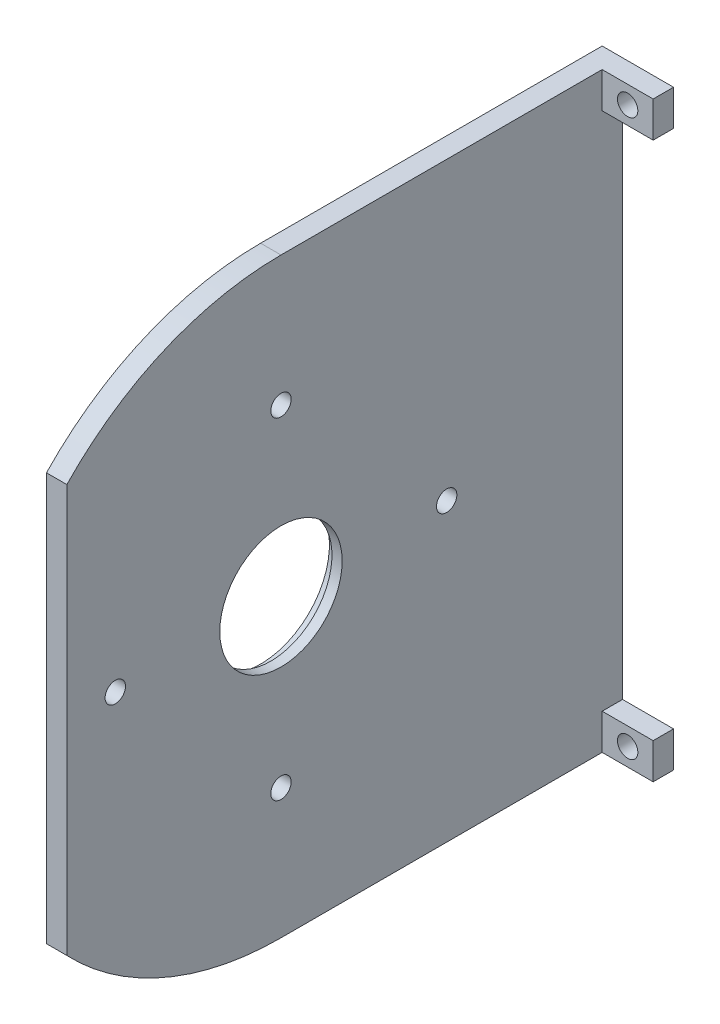
from build123d import *

# Parameters (mm, degrees)
SKETCH1_R           = 12
BOSS_EXTRUDE1_DEPTH = 4
SKETCH4_R           = 13.5
CUT_EXTRUDE2_DEPTH  = 2
SKETCH6_W           = 10
SKETCH6_H           = 7
SKETCH6_R           = 2
BOSS_EXTRUDE3_DEPTH = 4
CUT_EXTRUDE4_DEPTH  = 86.850160163
SKETCH13_R          = 2
CUT_EXTRUDE8_DEPTH  = 87.407464955


with BuildPart() as part:
    # Sketch1 → Boss-Extrude1 (new body)
    with BuildSketch(Plane(origin=(0, 0, 0), x_dir=(0, 0, -1), z_dir=(1, 0, 0))):
        with BuildLine():
            Line((62.5, 58), (-4.5, 58))
            ThreePointArc((-4.5, 58), (-62.5, 0), (-4.5, -58))
            Line((-4.5, -58), (62.5, -58))
            Line((62.5, -58), (62.5, 58))
        make_face()
        with Locations((-4.5, 0)):
            Circle(SKETCH1_R, mode=Mode.SUBTRACT)
    extrude(amount=BOSS_EXTRUDE1_DEPTH)

    # Sketch4 → Cut-Extrude2 (cut)
    with BuildSketch(Plane.ZY):
        with Locations((4.5, 0)):
            Circle(SKETCH4_R)
    extrude(amount=-CUT_EXTRUDE2_DEPTH, mode=Mode.SUBTRACT)

    # Sketch6 → Boss-Extrude3 (add)
    # profile 1 of 2: a face of its own
    with BuildSketch(Plane(origin=(0, 0, -62.5), x_dir=(-1, 0, 0), z_dir=(0, 0, -1))):
        with Locations((-9, 54.5)):
            Rectangle(SKETCH6_W, SKETCH6_H)
        with Locations((-9, 54.5)):
            Circle(SKETCH6_R, mode=Mode.SUBTRACT)
    # profile 2 of 2: a face of its own
    with BuildSketch(Plane(origin=(0, 0, -62.5), x_dir=(-1, 0, 0), z_dir=(0, 0, -1))):
        with Locations((-9, -54.5)):
            Rectangle(SKETCH6_W, SKETCH6_H)
        with Locations((-9, -54.5)):
            Circle(SKETCH6_R, mode=Mode.SUBTRACT)
    extrude(amount=-BOSS_EXTRUDE3_DEPTH)

    # Sketch9 → Cut-Extrude4 (cut, through all)
    with BuildSketch(Plane(origin=(4, 0, 0), x_dir=(0, 0, -1), z_dir=(1, 0, 0))):
        with BuildLine():
            Line((-46.5, 40), (-46.5, -40))
            ThreePointArc((-46.5, -40), (-62.5, 0), (-46.5, 40))
        make_face()
    extrude(amount=-CUT_EXTRUDE4_DEPTH, mode=Mode.SUBTRACT)

    # Sketch13 → Cut-Extrude8 (cut, through all)
    with BuildSketch(Plane.ZY):
        with Locations((4.5, 32.5)):
            Circle(SKETCH13_R)
        with Locations((37, 0)):
            Circle(SKETCH13_R)
        with Locations((4.5, -32.5)):
            Circle(SKETCH13_R)
        with Locations((-28, 0)):
            Circle(SKETCH13_R)
    extrude(amount=-CUT_EXTRUDE8_DEPTH, mode=Mode.SUBTRACT)


solid = part.part
